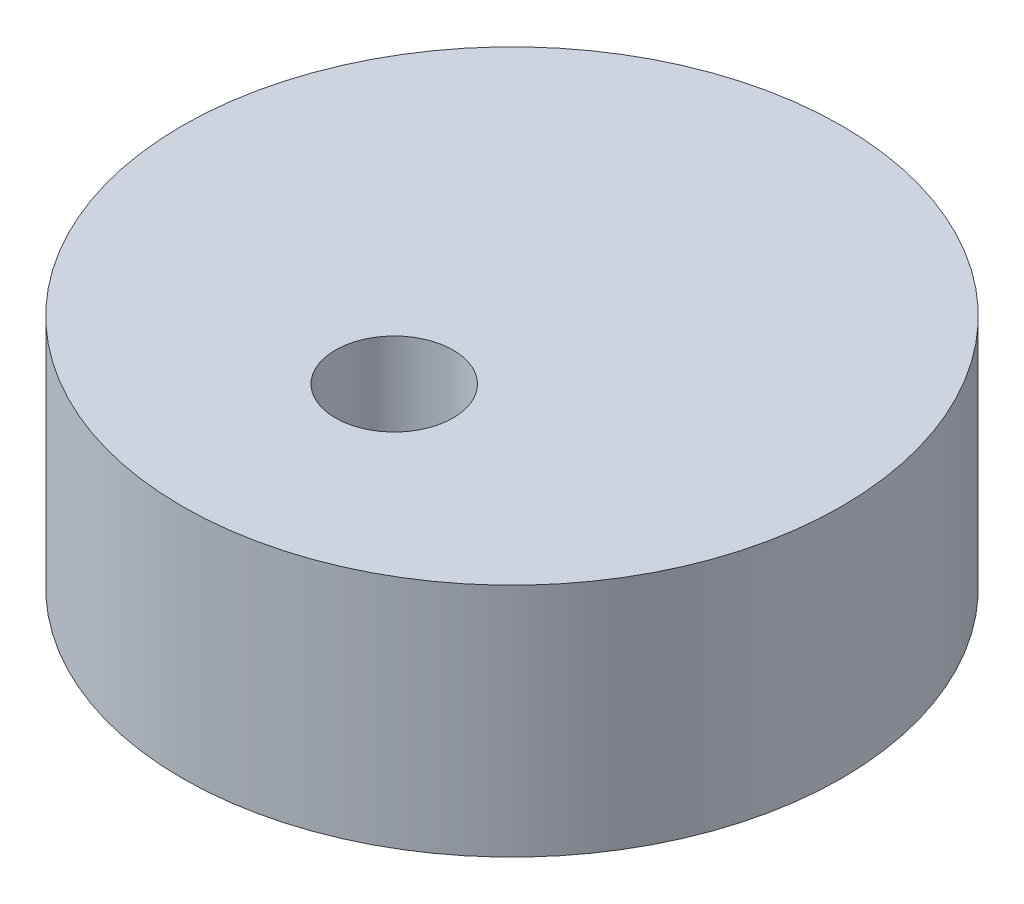
from build123d import *

# Parameters (mm, degrees)
SKETCH1_R           = 8.89
SKETCH1_R_2         = 1.5875
BOSS_EXTRUDE1_DEPTH = 6.35


with BuildPart() as part:
    # Sketch1 → Boss-Extrude1 (new body)
    with BuildSketch(Plane(origin=(0, 0, 0), x_dir=(1, 0, 0), z_dir=(0, 1, 0))):
        Circle(SKETCH1_R)
        with Locations((0, -3.175)):
            Circle(SKETCH1_R_2, mode=Mode.SUBTRACT)
    extrude(amount=BOSS_EXTRUDE1_DEPTH)


solid = part.part
